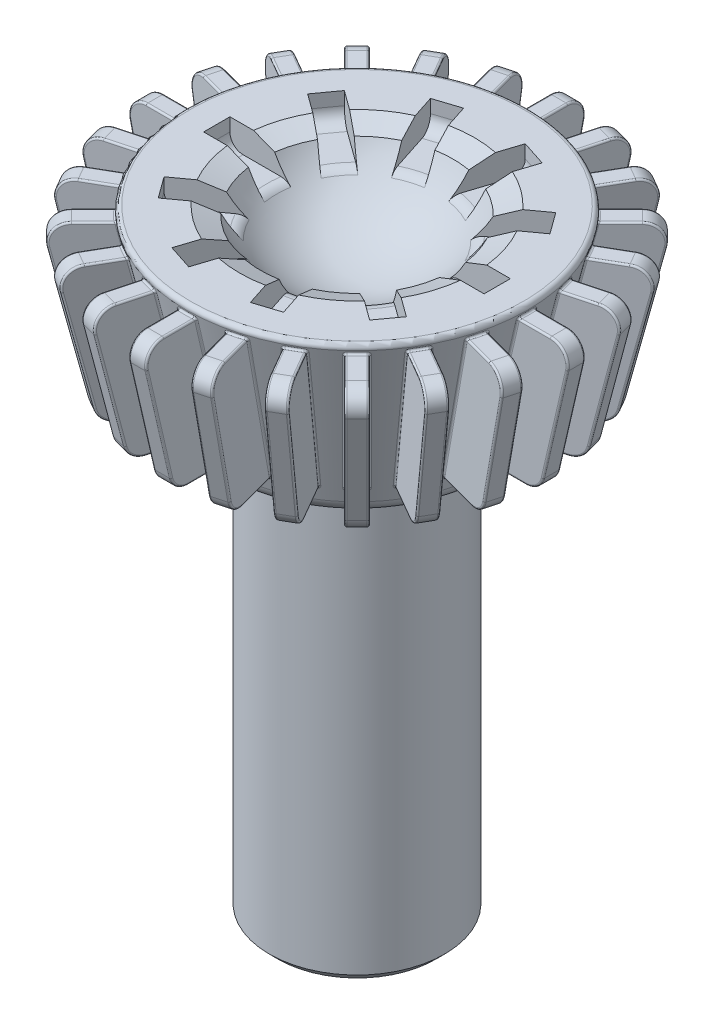
from build123d import *

# Parameters (mm, degrees)
SKETCH1_R           = 10
BOSS_EXTRUDE1_DEPTH = 50
SKETCH2_R           = 15
BOSS_EXTRUDE2_DEPTH = 20
BOSS_EXTRUDE2_DRAFT = -13
RIB1_START          = -1
RIB1_DEPTH          = 2
CIRPATTERN1_COUNT   = 24
FILLET1_R           = 0.5
FILLET2_R           = 2
SKETCH5_W           = 32
SKETCH5_H           = 3
CUT_EXTRUDE1_DEPTH  = 3
CIRPATTERN2_COUNT   = 10
FILLET3_R           = 1.5
CHAMFER1_SIZE       = 1.936051675
FILLET4_R           = 0.2
CHAMFER2_SIZE       = 1


with BuildPart() as part:
    # Sketch1 → Boss-Extrude1 (new body)
    with BuildSketch(Plane(origin=(0, 0, 0), x_dir=(1, 0, 0), z_dir=(0, 1, 0))):
        with Locations(Location((0, 0, 0), (0, 0, 270))):
            Circle(SKETCH1_R)
    extrude(amount=BOSS_EXTRUDE1_DEPTH)


with BuildPart() as boss_extrude2_tool:
    # Sketch2 → Boss-Extrude2 (with draft: the straight prism first)
    with BuildSketch(Plane(origin=(0, 50, 0), x_dir=(1, 0, 0), z_dir=(0, 1, 0))):
        Circle(SKETCH2_R)
    extrude(amount=BOSS_EXTRUDE2_DEPTH)
    # Boss-Extrude2: the draft: its side faces are tilted about the plane it starts from
    boss_extrude2_sides = [boss_extrude2_tool.faces().sort_by_distance(p)[0] for p in [
        (-15, 60, 0),
    ]]
    draft(boss_extrude2_sides, Plane(origin=(0, 50, 0), x_dir=(1, 0, 0), z_dir=(0, 1, 0)), BOSS_EXTRUDE2_DRAFT)


with BuildPart() as part_1:
    add(part.part)

    # Boss-Extrude2: add boss_extrude2_tool
    add(boss_extrude2_tool.part)

    # Rib1: read off the stored shape, not the designer's step
    # Rib1 outline → Rib1 (add)
    with BuildSketch(Plane.XY.offset(RIB1_START)):
        with BuildLine():
            Line((15, 53), (20.272158657, 53))
            ThreePointArc((20.272158657, 53), (21.51718793, 53.434783686), (22.220898786, 54.550097891))
            Line((22.220898786, 54.550097891), (24.99131708, 66.550097891))
            ThreePointArc((24.99131708, 66.550097891), (24.607793264, 68.245029273), (23.04257695, 69))
            Line((23.04257695, 69), (15, 69))
            Line((15, 69), (15, 53))
        make_face()
    rib1 = extrude(amount=RIB1_DEPTH)

    # CirPattern1: Rib1 ×24 about axis
    cirpattern1_axis = Axis((0, 0, 0), (0, 1, 0))
    for i in range(1, CIRPATTERN1_COUNT):
        add(rib1.rotate(cirpattern1_axis, i * 360 / CIRPATTERN1_COUNT))

    # Fillet1
    fillet1_edges = [part_1.edges().sort_by_distance(p)[0] for p in [
        (-19.617363823, 70, 0),
    ]]
    fillet(fillet1_edges, radius=FILLET1_R)

    # Fillet2
    fillet2_edges = [part_1.edges().sort_by_distance(p)[0] for p in [
        (0, 50, -10),
        (-15, 50, 0),
    ]]
    fillet(fillet2_edges, radius=FILLET2_R)

    # Sketch4 → Cut-Revolve1 (revolve, cut)
    with BuildSketch(Plane.XY):
        with BuildLine():
            Line((0, 87.5), (0, 62.5))
            ThreePointArc((0, 62.5), (12.5, 75), (0, 87.5))
        make_face()
    revolve(axis=Axis((0, 0, 0), (0, -1, 0)), mode=Mode.SUBTRACT)

    # Sketch5 → Cut-Extrude1 (cut)
    with BuildSketch(Plane(origin=(0, 70, 0), x_dir=(1, 0, 0), z_dir=(0, 1, 0))):
        Rectangle(SKETCH5_W, SKETCH5_H)
    cut_extrude1 = extrude(amount=-CUT_EXTRUDE1_DEPTH, mode=Mode.SUBTRACT)

    # CirPattern2: Cut-Extrude1 ×10 about axis
    cirpattern2_axis = Axis((0, 0, 0), (0, 1, 0))
    for i in range(1, CIRPATTERN2_COUNT):
        add(cut_extrude1.rotate(cirpattern2_axis, i * 360 / CIRPATTERN2_COUNT), mode=Mode.SUBTRACT)

    # Fillet3
    fillet3_edges = [part_1.edges().sort_by_distance(p)[0] for p in [
        (-9.604686356, 67, 0),
        (9.575177682, 67, -0.752311341),
        (16, 67, 0),
        (-16, 67, 0),
        (7.770354488, 67, -5.645492993),
        (2.96801131, 67, -9.134599546),
        (-2.96801131, 67, -9.134599546),
        (-7.770354488, 67, -5.645492993),
        (2.96801131, 67, 9.134599546),
        (7.770354488, 67, 5.645492993),
        (-7.770354488, 67, 5.645492993),
        (12.94427191, 67, 9.404564037),
        (-12.94427191, 67, -9.404564037),
        (-2.96801131, 67, 9.134599546),
        (-4.94427191, 67, -15.216904261),
        (4.94427191, 67, -15.216904261),
        (12.94427191, 67, -9.404564037),
        (4.94427191, 67, 15.216904261),
        (-4.94427191, 67, 15.216904261),
        (-12.94427191, 67, 9.404564037),
    ]]
    fillet(fillet3_edges, radius=FILLET3_R)

    # Chamfer1
    # the kernel refuses this chamfer: 1.936051675, 1 mm, written as the material it takes off along each edge
    with BuildSketch(Plane(origin=(0, 70, 0), x_dir=(-0.5935957713942983, 0, -0.8047633566352335), z_dir=(0.8047633566352335, 0, -0.5935957713942983))) as chamfer1_piece_1:
        with BuildLine():
            Line((10.998981389, -0.939057871), (11.456439237 + CHAMFER1_SIZE, 0))
            Line((11.456439237 + CHAMFER1_SIZE, 0), (11.456439237, 0))
            ThreePointArc((11.456439237, 0), (11.22497563, -0.499992918), (10.998981389, -0.939057871))
        make_face()
    revolve(axis=Axis((0, 70, 0), (0, 1, 0)), revolution_arc=71.174815129, mode=Mode.SUBTRACT)
    with BuildSketch(Plane(origin=(0, 70, 0), x_dir=(0.593595771394299, 0, 0.8047633566352328), z_dir=(-0.8047633566352328, 0, 0.593595771394299))) as chamfer1_piece_2:
        with BuildLine():
            Line((10.998981389, -0.939057871), (11.456439237 + CHAMFER1_SIZE, 0))
            Line((11.456439237 + CHAMFER1_SIZE, 0), (11.456439237, 0))
            ThreePointArc((11.456439237, 0), (11.22497563, -0.499992918), (10.998981389, -0.939057871))
        make_face()
    revolve(axis=Axis((0, 70, 0), (0, 1, 0)), revolution_arc=71.174815129, mode=Mode.SUBTRACT)
    with BuildSketch(Plane(origin=(0, 70, 0), x_dir=(-0.007201034231532295, 0, -0.9999740722168732), z_dir=(0.9999740722168732, 0, -0.007201034231532295))) as chamfer1_piece_3:
        with BuildLine():
            Line((10.998981389, -0.939057871), (11.456439237 + CHAMFER1_SIZE, 0))
            Line((11.456439237 + CHAMFER1_SIZE, 0), (11.456439237, 0))
            ThreePointArc((11.456439237, 0), (11.22497563, -0.499992918), (10.998981389, -0.939057871))
        make_face()
    revolve(axis=Axis((0, 70, 0), (0, 1, 0)), revolution_arc=71.174815129, mode=Mode.SUBTRACT)
    with BuildSketch(Plane(origin=(0, 70, 0), x_dir=(0.581944253253538, 0, -0.8132286800803215), z_dir=(0.8132286800803215, 0, 0.581944253253538))) as chamfer1_piece_4:
        with BuildLine():
            Line((10.998981389, -0.939057871), (11.456439237 + CHAMFER1_SIZE, 0))
            Line((11.456439237 + CHAMFER1_SIZE, 0), (11.456439237, 0))
            ThreePointArc((11.456439237, 0), (11.22497563, -0.499992918), (10.998981389, -0.939057871))
        make_face()
    revolve(axis=Axis((0, 70, 0), (0, 1, 0)), revolution_arc=71.174815129, mode=Mode.SUBTRACT)
    with BuildSketch(Plane(origin=(0, 70, 0), x_dir=(0.9488066155534414, 0, -0.31585757277928966), z_dir=(0.31585757277928966, 0, 0.9488066155534414))) as chamfer1_piece_5:
        with BuildLine():
            Line((10.998981389, -0.939057871), (11.456439237 + CHAMFER1_SIZE, 0))
            Line((11.456439237 + CHAMFER1_SIZE, 0), (11.456439237, 0))
            ThreePointArc((11.456439237, 0), (11.22497563, -0.499992918), (10.998981389, -0.939057871))
        make_face()
    revolve(axis=Axis((0, 70, 0), (0, 1, 0)), revolution_arc=71.174815129, mode=Mode.SUBTRACT)
    with BuildSketch(Plane(origin=(0, 70, 0), x_dir=(0.9532570994626822, 0, 0.3021603917193551), z_dir=(-0.3021603917193551, 0, 0.9532570994626822))) as chamfer1_piece_6:
        with BuildLine():
            Line((10.998981389, -0.939057871), (11.456439237 + CHAMFER1_SIZE, 0))
            Line((11.456439237 + CHAMFER1_SIZE, 0), (11.456439237, 0))
            ThreePointArc((11.456439237, 0), (11.22497563, -0.499992918), (10.998981389, -0.939057871))
        make_face()
    revolve(axis=Axis((0, 70, 0), (0, 1, 0)), revolution_arc=71.174815129, mode=Mode.SUBTRACT)
    with BuildSketch(Plane(origin=(0, 70, 0), x_dir=(0.00720103423153306, 0, 0.9999740722168732), z_dir=(-0.9999740722168732, 0, 0.00720103423153306))) as chamfer1_piece_7:
        with BuildLine():
            Line((10.998981389, -0.939057871), (11.456439237 + CHAMFER1_SIZE, 0))
            Line((11.456439237 + CHAMFER1_SIZE, 0), (11.456439237, 0))
            ThreePointArc((11.456439237, 0), (11.22497563, -0.499992918), (10.998981389, -0.939057871))
        make_face()
    revolve(axis=Axis((0, 70, 0), (0, 1, 0)), revolution_arc=71.174815129, mode=Mode.SUBTRACT)
    with BuildSketch(Plane(origin=(0, 70, 0), x_dir=(-0.5819442532535384, 0, 0.8132286800803215), z_dir=(-0.8132286800803215, 0, -0.5819442532535384))) as chamfer1_piece_8:
        with BuildLine():
            Line((10.998981389, -0.939057871), (11.456439237 + CHAMFER1_SIZE, 0))
            Line((11.456439237 + CHAMFER1_SIZE, 0), (11.456439237, 0))
            ThreePointArc((11.456439237, 0), (11.22497563, -0.499992918), (10.998981389, -0.939057871))
        make_face()
    revolve(axis=Axis((0, 70, 0), (0, 1, 0)), revolution_arc=71.174815129, mode=Mode.SUBTRACT)
    with BuildSketch(Plane(origin=(0, 70, 0), x_dir=(-0.9488066155534409, 0, 0.3158575727792908), z_dir=(-0.3158575727792908, 0, -0.9488066155534409))) as chamfer1_piece_9:
        with BuildLine():
            Line((10.998981389, -0.939057871), (11.456439237 + CHAMFER1_SIZE, 0))
            Line((11.456439237 + CHAMFER1_SIZE, 0), (11.456439237, 0))
            ThreePointArc((11.456439237, 0), (11.22497563, -0.499992918), (10.998981389, -0.939057871))
        make_face()
    revolve(axis=Axis((0, 70, 0), (0, 1, 0)), revolution_arc=71.174815129, mode=Mode.SUBTRACT)
    with BuildSketch(Plane(origin=(0, 70, 0), x_dir=(-0.9532570994626688, 0, -0.3021603917193974), z_dir=(0.3021603917193974, 0, -0.9532570994626688))) as chamfer1_piece_10:
        with BuildLine():
            Line((10.998981389, -0.939057871), (11.456439237 + CHAMFER1_SIZE, 0))
            Line((11.456439237 + CHAMFER1_SIZE, 0), (11.456439237, 0))
            ThreePointArc((11.456439237, 0), (11.22497563, -0.499992918), (10.998981389, -0.939057871))
        make_face()
    revolve(axis=Axis((0, 70, 0), (0, 1, 0)), revolution_arc=71.174815129, mode=Mode.SUBTRACT)

    # Fillet4
    fillet4_edges = [part_1.edges().sort_by_distance(p)[0] for p in [
        (7.889476391, 60.999929485, -15.664973954),
        (19.380042475, 69, 0.50016649),
        (9.693247816, 69, -16.789197707),
        (7.846302287, 53, -13.590194212),
        (9.621527199, 60.999929485, -14.664973954),
        (9.849242573, 53, -15.059388552),
        (11.466841467, 69, -17.861152023),
        (15.684628908, 53, 0.500254251),
        (8.117191765, 53, -16.059388552),
        (9.73479066, 69, -18.861152023),
        (11.437871228, 68.245029273, -21.810974098),
        (10.937028563, 60.550097891, -20.943489154),
        (9.892568561, 53.434783686, -19.134431365),
        (11.624619369, 53.434783686, -18.134431365),
        (12.66907937, 60.550097891, -19.943489154),
        (17.51100359, 60.999929485, 1),
        (13.169922036, 68.245029273, -20.810974098),
        (3.566255402, 60.999929485, -17.173149657),
        (5.017594287, 69, -18.725916812),
        (4.061544931, 53, -15.157892039),
        (5.498107054, 60.999929485, -16.655511566),
        (5.615981206, 53, -17.095423888),
        (6.453312008, 69, -20.220384986),
        (3.684129553, 53, -17.613061978),
        (4.521460355, 69, -20.738023076),
        (5.403039728, 68.245029273, -24.028122087),
        (5.143784488, 60.550097891, -23.060568356),
        (4.603132207, 53.434783686, -21.042826576),
        (6.53498386, 53.434783686, -20.525188486),
        (7.07563614, 60.550097891, -22.542930266),
        (7.334891381, 68.245029273, -23.510483996),
        (17.966434338, 53, 1),
        (21.201632127, 69, 1),
        (-1, 60.999929485, -17.51100359),
        (0, 69, -19.386495631),
        (17.966434338, 53, -1),
        (0, 53, -15.692604573),
        (1, 60.999929485, -17.51100359),
        (1, 53, -17.966434338),
        (1, 69, -21.201632127),
        (-1, 53, -17.966434338),
        (-1, 69, -21.201632127),
        (-1, 68.245029273, -24.607793264),
        (-1, 60.550097891, -23.606107933),
        (21.201632127, 69, -1),
        (-1, 53.434783686, -21.51718793),
        (1, 53.434783686, -21.51718793),
        (1, 60.550097891, -23.606107933),
        (1, 68.245029273, -24.607793264),
        (24.607793264, 68.245029273, -1),
        (23.606107933, 60.550097891, -1),
        (21.51718793, 53.434783686, -1),
        (21.51718793, 53.434783686, 1),
        (23.606107933, 60.550097891, 1),
        (-5.498107054, 60.999929485, -16.655511566),
        (-5.017594287, 69, -18.725916812),
        (-4.061544931, 53, -15.157892039),
        (-3.566255402, 60.999929485, -17.173149657),
        (24.607793264, 68.245029273, 1),
        (-3.684129553, 53, -17.613061978),
        (-4.521460355, 69, -20.738023076),
        (-5.615981206, 53, -17.095423888),
        (-6.453312008, 69, -20.220384986),
        (-7.334891381, 68.245029273, -23.510483996),
        (-7.07563614, 60.550097891, -22.542930266),
        (-6.53498386, 53.434783686, -20.525188486),
        (-4.603132207, 53.434783686, -21.042826576),
        (-5.143784488, 60.550097891, -23.060568356),
        (-5.403039728, 68.245029273, -24.028122087),
        (-9.621527199, 60.999929485, -14.664973954),
        (-9.693247816, 69, -16.789197707),
        (-7.846302287, 53, -13.590194212),
        (-7.889476391, 60.999929485, -15.664973954),
        (-8.117191765, 53, -16.059388552),
        (-9.73479066, 69, -18.861152023),
        (-9.849242573, 53, -15.059388552),
        (-11.466841467, 69, -17.861152023),
        (-13.169922036, 68.245029273, -20.810974098),
        (-12.66907937, 60.550097891, -19.943489154),
        (-11.624619369, 53.434783686, -18.134431365),
        (-9.892568561, 53.434783686, -19.134431365),
        (-10.937028563, 60.550097891, -20.943489154),
        (-11.437871228, 68.245029273, -21.810974098),
        (-13.089256165, 60.999929485, -11.675042602),
        (-13.708322524, 69, -13.708322524),
        (-11.096347108, 53, -11.096347108),
        (-11.675042602, 60.999929485, -13.089256165),
        (-11.997080773, 53, -13.411294335),
        (-14.284711068, 69, -15.69892463),
        (-13.411294335, 53, -11.997080773),
        (-15.69892463, 69, -14.284711068),
        (-18.107444268, 68.245029273, -16.693230706),
        (-17.399145778, 60.550097891, -15.984932216),
        (-15.922056279, 53.434783686, -14.507842716),
        (-14.507842716, 53.434783686, -15.922056279),
        (-15.984932216, 60.550097891, -17.399145778),
        (-16.693230706, 68.245029273, -18.107444268),
        (-15.664973954, 60.999929485, -7.889476391),
        (-16.789197707, 69, -9.693247816),
        (-13.590194212, 53, -7.846302287),
        (-14.664973954, 60.999929485, -9.621527199),
        (-15.059388552, 53, -9.849242573),
        (-17.861152023, 69, -11.466841467),
        (-16.059388552, 53, -8.117191765),
        (-18.861152023, 69, -9.73479066),
        (-21.810974098, 68.245029273, -11.437871228),
        (-20.943489154, 60.550097891, -10.937028563),
        (-19.134431365, 53.434783686, -9.892568561),
        (-18.134431365, 53.434783686, -11.624619369),
        (-19.943489154, 60.550097891, -12.66907937),
        (-20.810974098, 68.245029273, -13.169922036),
        (-17.173149657, 60.999929485, -3.566255402),
        (-18.725916812, 69, -5.017594287),
        (-15.157892039, 53, -4.061544931),
        (-16.655511566, 60.999929485, -5.498107054),
        (-17.095423888, 53, -5.615981206),
        (-20.220384986, 69, -6.453312008),
        (-17.613061978, 53, -3.684129553),
        (-20.738023076, 69, -4.521460355),
        (-24.028122087, 68.245029273, -5.403039728),
        (-23.060568356, 60.550097891, -5.143784488),
        (-21.042826576, 53.434783686, -4.603132207),
        (-20.525188486, 53.434783686, -6.53498386),
        (-22.542930266, 60.550097891, -7.07563614),
        (-23.510483996, 68.245029273, -7.334891381),
        (-17.966434338, 53, -1),
        (-15.692604573, 53, 0),
        (-21.201632127, 69, -1),
        (-17.51100359, 60.999929485, -1),
        (-17.966434338, 53, 1),
        (-17.51100359, 60.999929485, 1),
        (-21.201632127, 69, 1),
        (-24.607793264, 68.245029273, 1),
        (-23.606107933, 60.550097891, 1),
        (-21.51718793, 53.434783686, 1),
        (-21.51718793, 53.434783686, -1),
        (-23.606107933, 60.550097891, -1),
        (-24.607793264, 68.245029273, -1),
        (-19.386495631, 69, 0),
        (-17.613061978, 53, 3.684129553),
        (-15.157892039, 53, 4.061544931),
        (-20.738023076, 69, 4.521460355),
        (-17.173149657, 60.999929485, 3.566255402),
        (-17.095423888, 53, 5.615981206),
        (-16.655511566, 60.999929485, 5.498107054),
        (-20.220384986, 69, 6.453312008),
        (-23.510483996, 68.245029273, 7.334891381),
        (-22.542930266, 60.550097891, 7.07563614),
        (-20.525188486, 53.434783686, 6.53498386),
        (-21.042826576, 53.434783686, 4.603132207),
        (-23.060568356, 60.550097891, 5.143784488),
        (-24.028122087, 68.245029273, 5.403039728),
        (-18.725916812, 69, 5.017594287),
        (16.655511566, 60.999929485, -5.498107054),
        (-16.059388552, 53, 8.117191765),
        (-13.590194212, 53, 7.846302287),
        (-18.861152023, 69, 9.73479066),
        (-15.664973954, 60.999929485, 7.889476391),
        (-15.059388552, 53, 9.849242573),
        (-14.664973954, 60.999929485, 9.621527199),
        (-17.861152023, 69, 11.466841467),
        (-20.810974098, 68.245029273, 13.169922036),
        (-19.943489154, 60.550097891, 12.66907937),
        (-18.134431365, 53.434783686, 11.624619369),
        (18.725916812, 69, -5.017594287),
        (-19.134431365, 53.434783686, 9.892568561),
        (-20.943489154, 60.550097891, 10.937028563),
        (-21.810974098, 68.245029273, 11.437871228),
        (-16.789197707, 69, 9.693247816),
        (15.157892039, 53, -4.061544931),
        (17.173149657, 60.999929485, -3.566255402),
        (-13.411294335, 53, 11.997080773),
        (-11.096347108, 53, 11.096347108),
        (-15.69892463, 69, 14.284711068),
        (-13.089256165, 60.999929485, 11.675042602),
        (-11.997080773, 53, 13.411294335),
        (-11.675042602, 60.999929485, 13.089256165),
        (-14.284711068, 69, 15.69892463),
        (-16.693230706, 68.245029273, 18.107444268),
        (-15.984932216, 60.550097891, 17.399145778),
        (-14.507842716, 53.434783686, 15.922056279),
        (-15.922056279, 53.434783686, 14.507842716),
        (-17.399145778, 60.550097891, 15.984932216),
        (-18.107444268, 68.245029273, 16.693230706),
        (-13.708322524, 69, 13.708322524),
        (17.613061978, 53, -3.684129553),
        (20.738023076, 69, -4.521460355),
        (17.095423888, 53, -5.615981206),
        (-9.849242573, 53, 15.059388552),
        (-7.846302287, 53, 13.590194212),
        (-11.466841467, 69, 17.861152023),
        (20.220384986, 69, -6.453312008),
        (-9.621527199, 60.999929485, 14.664973954),
        (-8.117191765, 53, 16.059388552),
        (-7.889476391, 60.999929485, 15.664973954),
        (-9.73479066, 69, 18.861152023),
        (-11.437871228, 68.245029273, 21.810974098),
        (-10.937028563, 60.550097891, 20.943489154),
        (-9.892568561, 53.434783686, 19.134431365),
        (23.510483996, 68.245029273, -7.334891381),
        (-11.624619369, 53.434783686, 18.134431365),
        (-12.66907937, 60.550097891, 19.943489154),
        (-13.169922036, 68.245029273, 20.810974098),
        (22.542930266, 60.550097891, -7.07563614),
        (-9.693247816, 69, 16.789197707),
        (20.525188486, 53.434783686, -6.53498386),
        (21.042826576, 53.434783686, -4.603132207),
        (23.060568356, 60.550097891, -5.143784488),
        (24.028122087, 68.245029273, -5.403039728),
        (-5.615981206, 53, 17.095423888),
        (-4.061544931, 53, 15.157892039),
        (-6.453312008, 69, 20.220384986),
        (-5.498107054, 60.999929485, 16.655511566),
        (-3.684129553, 53, 17.613061978),
        (-3.566255402, 60.999929485, 17.173149657),
        (-4.521460355, 69, 20.738023076),
        (-5.403039728, 68.245029273, 24.028122087),
        (-5.143784488, 60.550097891, 23.060568356),
        (-4.603132207, 53.434783686, 21.042826576),
        (-6.53498386, 53.434783686, 20.525188486),
        (-7.07563614, 60.550097891, 22.542930266),
        (-7.334891381, 68.245029273, 23.510483996),
        (-5.017594287, 69, 18.725916812),
        (-1, 53, 17.966434338),
        (0, 53, 15.692604573),
        (-1, 69, 21.201632127),
        (-1, 60.999929485, 17.51100359),
        (1, 53, 17.966434338),
        (1, 60.999929485, 17.51100359),
        (1, 69, 21.201632127),
        (1, 68.245029273, 24.607793264),
        (1, 60.550097891, 23.606107933),
        (1, 53.434783686, 21.51718793),
        (-1, 53.434783686, 21.51718793),
        (-1, 60.550097891, 23.606107933),
        (-1, 68.245029273, 24.607793264),
        (0, 69, 19.386495631),
        (3.684129553, 53, 17.613061978),
        (4.061544931, 53, 15.157892039),
        (4.521460355, 69, 20.738023076),
        (3.566255402, 60.999929485, 17.173149657),
        (5.615981206, 53, 17.095423888),
        (5.498107054, 60.999929485, 16.655511566),
        (6.453312008, 69, 20.220384986),
        (7.334891381, 68.245029273, 23.510483996),
        (7.07563614, 60.550097891, 22.542930266),
        (6.53498386, 53.434783686, 20.525188486),
        (4.603132207, 53.434783686, 21.042826576),
        (5.143784488, 60.550097891, 23.060568356),
        (5.403039728, 68.245029273, 24.028122087),
        (5.017594287, 69, 18.725916812),
        (8.117191765, 53, 16.059388552),
        (7.846302287, 53, 13.590194212),
        (9.73479066, 69, 18.861152023),
        (7.889476391, 60.999929485, 15.664973954),
        (9.849242573, 53, 15.059388552),
        (9.621527199, 60.999929485, 14.664973954),
        (11.466841467, 69, 17.861152023),
        (13.169922036, 68.245029273, 20.810974098),
        (12.66907937, 60.550097891, 19.943489154),
        (11.624619369, 53.434783686, 18.134431365),
        (9.892568561, 53.434783686, 19.134431365),
        (10.937028563, 60.550097891, 20.943489154),
        (11.437871228, 68.245029273, 21.810974098),
        (9.693247816, 69, 16.789197707),
        (11.997080773, 53, 13.411294335),
        (11.096347108, 53, 11.096347108),
        (14.284711068, 69, 15.69892463),
        (11.675042602, 60.999929485, 13.089256165),
        (13.411294335, 53, 11.997080773),
        (13.089256165, 60.999929485, 11.675042602),
        (15.69892463, 69, 14.284711068),
        (18.107444268, 68.245029273, 16.693230706),
        (17.399145778, 60.550097891, 15.984932216),
        (15.922056279, 53.434783686, 14.507842716),
        (14.507842716, 53.434783686, 15.922056279),
        (15.984932216, 60.550097891, 17.399145778),
        (16.693230706, 68.245029273, 18.107444268),
        (13.708322524, 69, 13.708322524),
        (15.059388552, 53, 9.849242573),
        (13.590194212, 53, 7.846302287),
        (17.861152023, 69, 11.466841467),
        (14.664973954, 60.999929485, 9.621527199),
        (16.059388552, 53, 8.117191765),
        (15.664973954, 60.999929485, 7.889476391),
        (18.861152023, 69, 9.73479066),
        (21.810974098, 68.245029273, 11.437871228),
        (20.943489154, 60.550097891, 10.937028563),
        (19.134431365, 53.434783686, 9.892568561),
        (18.134431365, 53.434783686, 11.624619369),
        (19.943489154, 60.550097891, 12.66907937),
        (20.810974098, 68.245029273, 13.169922036),
        (16.789197707, 69, 9.693247816),
        (14.664973954, 60.999929485, -9.621527199),
        (16.789197707, 69, -9.693247816),
        (13.590194212, 53, -7.846302287),
        (17.095423888, 53, 5.615981206),
        (15.157892039, 53, 4.061544931),
        (20.220384986, 69, 6.453312008),
        (16.655511566, 60.999929485, 5.498107054),
        (17.613061978, 53, 3.684129553),
        (17.173149657, 60.999929485, 3.566255402),
        (20.738023076, 69, 4.521460355),
        (24.028122087, 68.245029273, 5.403039728),
        (15.664973954, 60.999929485, -7.889476391),
        (23.060568356, 60.550097891, 5.143784488),
        (21.042826576, 53.434783686, 4.603132207),
        (20.525188486, 53.434783686, 6.53498386),
        (22.542930266, 60.550097891, 7.07563614),
        (23.510483996, 68.245029273, 7.334891381),
        (18.725916812, 69, 5.017594287),
        (16.059388552, 53, -8.117191765),
        (18.861152023, 69, -9.73479066),
        (15.059388552, 53, -9.849242573),
        (17.861152023, 69, -11.466841467),
        (20.810974098, 68.245029273, -13.169922036),
        (19.943489154, 60.550097891, -12.66907937),
        (18.134431365, 53.434783686, -11.624619369),
        (19.134431365, 53.434783686, -9.892568561),
        (20.943489154, 60.550097891, -10.937028563),
        (21.810974098, 68.245029273, -11.437871228),
        (11.675042602, 60.999929485, -13.089256165),
        (13.708322524, 69, -13.708322524),
        (11.096347108, 53, -11.096347108),
        (13.089256165, 60.999929485, -11.675042602),
        (13.411294335, 53, -11.997080773),
        (15.69892463, 69, -14.284711068),
        (11.997080773, 53, -13.411294335),
        (14.284711068, 69, -15.69892463),
        (16.693230706, 68.245029273, -18.107444268),
        (15.984932216, 60.550097891, -17.399145778),
        (14.507842716, 53.434783686, -15.922056279),
        (15.922056279, 53.434783686, -14.507842716),
        (17.399145778, 60.550097891, -15.984932216),
        (18.107444268, 68.245029273, -16.693230706),
        (17.51100359, 60.999929485, -1),
    ]]
    fillet(fillet4_edges, radius=FILLET4_R)

    # Chamfer2
    chamfer2_edges = [part_1.edges().sort_by_distance(p)[0] for p in [
        (0, 0, -10),
    ]]
    chamfer(chamfer2_edges, length=CHAMFER2_SIZE)


solid = part_1.part
